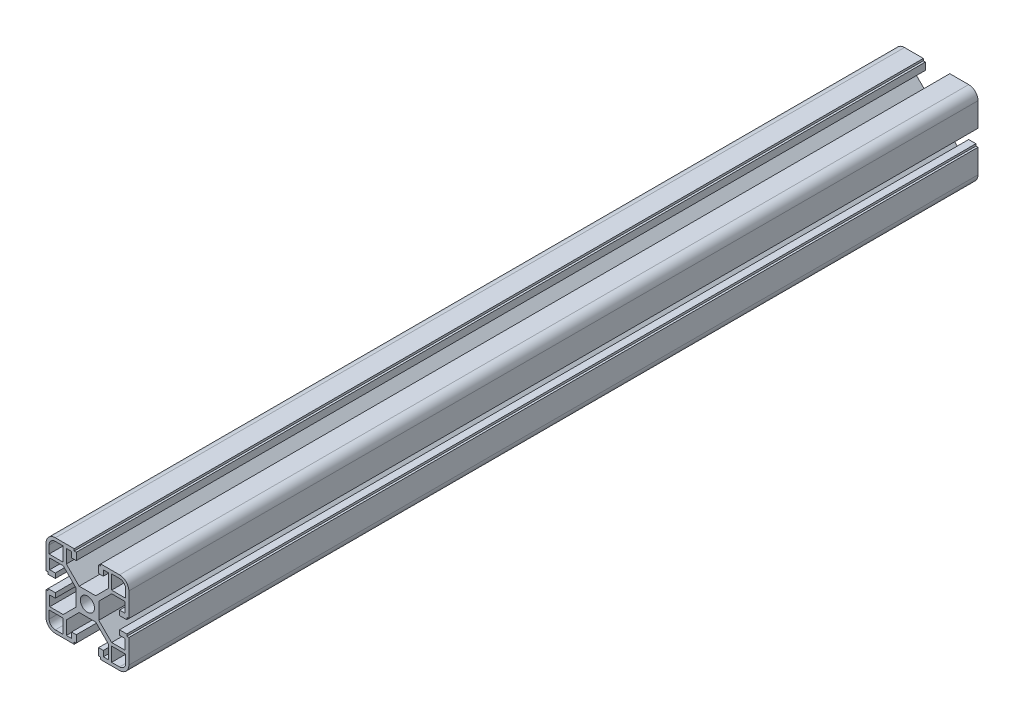
from build123d import *
from build123d.topology import SkipClean

# Parameters (mm, degrees)
BOSS_EXTRUDE1_DEPTH  = 410
MIRROR3_COPY_1_DEPTH = 410
MIRROR3_COPY_2_DEPTH = 410


with BuildPart() as part:
    # Sketch1 → Boss-Extrude1 (new body)
    with BuildSketch(Plane.XY):
        with BuildLine():
            Line((3.4, 0), (5.5, 0))
            Line((5.5, 0), (5.5, 4))
            Line((5.5, 4), (11.69, 10.19))
            Line((11.69, 10.19), (18.2, 10.19))
            Line((18.2, 10.19), (18.2, 5.265595036))
            Line((18.2, 5.265595036), (15.5, 5.265595036))
            Line((15.5, 5.265595036), (15.5, 2.965595036))
            Line((15.5, 2.965595036), (19, 2.965595036))
            Line((19, 2.965595036), (19, 3.965595036))
            Line((19, 3.965595036), (20, 3.965595036))
            Line((20, 3.965595036), (20, 15.5))
            ThreePointArc((20, 15.5), (18.681980515, 18.681980515), (15.5, 20))
            Line((15.5, 20), (6.385304712, 20))
            Line((6.385304712, 20), (6.385304712, 19))
            Line((6.385304712, 19), (5.385304712, 19))
            Line((5.385304712, 19), (5.385304712, 15.5))
            Line((5.385304712, 15.5), (7.685304712, 15.5))
            Line((7.685304712, 15.5), (7.685304712, 18.2))
            Line((7.685304712, 18.2), (10.19, 18.2))
            Line((10.19, 18.2), (10.19, 11.69))
            Line((10.19, 11.69), (4, 5.5))
            Line((4, 5.5), (0, 5.5))
            Line((0, 5.5), (0, 3.4))
            ThreePointArc((0, 3.4), (2.404163056, 2.404163056), (3.4, 0))
        make_face()
        with BuildLine():
            Line((18.5, 11.69), (18.5, 15.5))
            ThreePointArc((18.5, 15.5), (17.621320344, 17.621320344), (15.5, 18.5))
            Line((15.5, 18.5), (11.69, 18.5))
            Line((11.69, 18.5), (11.69, 11.69))
            Line((11.69, 11.69), (18.5, 11.69))
        make_face(mode=Mode.SUBTRACT)
    boss_extrude1 = extrude(amount=BOSS_EXTRUDE1_DEPTH)

    # Mirror1: Boss-Extrude1 across plane
    add(boss_extrude1.mirror(Plane.ZX))

    # Mirror2: Boss-Extrude1 across plane
    add(boss_extrude1.mirror(Plane(origin=(0, 0, 0), x_dir=(0, 0, 1), z_dir=(1, 0, 0))))

    # Mirror3 copy 1 sketch → Mirror3 copy 1 (add)
    with BuildSketch(Plane(origin=(0, 0, 0), x_dir=(-1, 0, 0), z_dir=(0, 0, 1))):
        with BuildLine():
            Line((3.4, 0), (5.5, 0))
            Line((5.5, 0), (5.5, 4))
            Line((5.5, 4), (11.69, 10.19))
            Line((11.69, 10.19), (18.2, 10.19))
            Line((18.2, 10.19), (18.2, 5.265595036))
            Line((18.2, 5.265595036), (15.5, 5.265595036))
            Line((15.5, 5.265595036), (15.5, 2.965595036))
            Line((15.5, 2.965595036), (19, 2.965595036))
            Line((19, 2.965595036), (19, 3.965595036))
            Line((19, 3.965595036), (20, 3.965595036))
            Line((20, 3.965595036), (20, 15.5))
            ThreePointArc((20, 15.5), (18.681980515, 18.681980515), (15.5, 20))
            Line((15.5, 20), (6.385304712, 20))
            Line((6.385304712, 20), (6.385304712, 19))
            Line((6.385304712, 19), (5.385304712, 19))
            Line((5.385304712, 19), (5.385304712, 15.5))
            Line((5.385304712, 15.5), (7.685304712, 15.5))
            Line((7.685304712, 15.5), (7.685304712, 18.2))
            Line((7.685304712, 18.2), (10.19, 18.2))
            Line((10.19, 18.2), (10.19, 11.69))
            Line((10.19, 11.69), (4, 5.5))
            Line((4, 5.5), (0, 5.5))
            Line((0, 5.5), (0, 3.4))
            ThreePointArc((0, 3.4), (2.404163056, 2.404163056), (3.4, 0))
        make_face()
        with BuildLine():
            Line((18.5, 11.69), (18.5, 15.5))
            ThreePointArc((18.5, 15.5), (17.621320344, 17.621320344), (15.5, 18.5))
            Line((15.5, 18.5), (11.69, 18.5))
            Line((11.69, 18.5), (11.69, 11.69))
            Line((11.69, 11.69), (18.5, 11.69))
        make_face(mode=Mode.SUBTRACT)
    extrude(amount=MIRROR3_COPY_1_DEPTH)

    # Mirror3 copy 2 sketch → Mirror3 copy 2 (add)
    with SkipClean():  # the faces are left unmerged after this step: merging them gives an invalid solid
        with BuildSketch(Plane.XY):
            with BuildLine():
                Line((3.4, 0), (5.5, 0))
                Line((5.5, 0), (5.5, -4))
                Line((5.5, -4), (11.69, -10.19))
                Line((11.69, -10.19), (18.2, -10.19))
                Line((18.2, -10.19), (18.2, -5.265595036))
                Line((18.2, -5.265595036), (15.5, -5.265595036))
                Line((15.5, -5.265595036), (15.5, -2.965595036))
                Line((15.5, -2.965595036), (19, -2.965595036))
                Line((19, -2.965595036), (19, -3.965595036))
                Line((19, -3.965595036), (20, -3.965595036))
                Line((20, -3.965595036), (20, -15.5))
                ThreePointArc((20, -15.5), (18.681980515, -18.681980515), (15.5, -20))
                Line((15.5, -20), (6.385304712, -20))
                Line((6.385304712, -20), (6.385304712, -19))
                Line((6.385304712, -19), (5.385304712, -19))
                Line((5.385304712, -19), (5.385304712, -15.5))
                Line((5.385304712, -15.5), (7.685304712, -15.5))
                Line((7.685304712, -15.5), (7.685304712, -18.2))
                Line((7.685304712, -18.2), (10.19, -18.2))
                Line((10.19, -18.2), (10.19, -11.69))
                Line((10.19, -11.69), (4, -5.5))
                Line((4, -5.5), (0, -5.5))
                Line((0, -5.5), (0, -3.4))
                ThreePointArc((0, -3.4), (2.404163056, -2.404163056), (3.4, 0))
            make_face()
            with BuildLine():
                Line((18.5, -11.69), (18.5, -15.5))
                ThreePointArc((18.5, -15.5), (17.621320344, -17.621320344), (15.5, -18.5))
                Line((15.5, -18.5), (11.69, -18.5))
                Line((11.69, -18.5), (11.69, -11.69))
                Line((11.69, -11.69), (18.5, -11.69))
            make_face(mode=Mode.SUBTRACT)
        extrude(amount=MIRROR3_COPY_2_DEPTH)


solid = part.part
